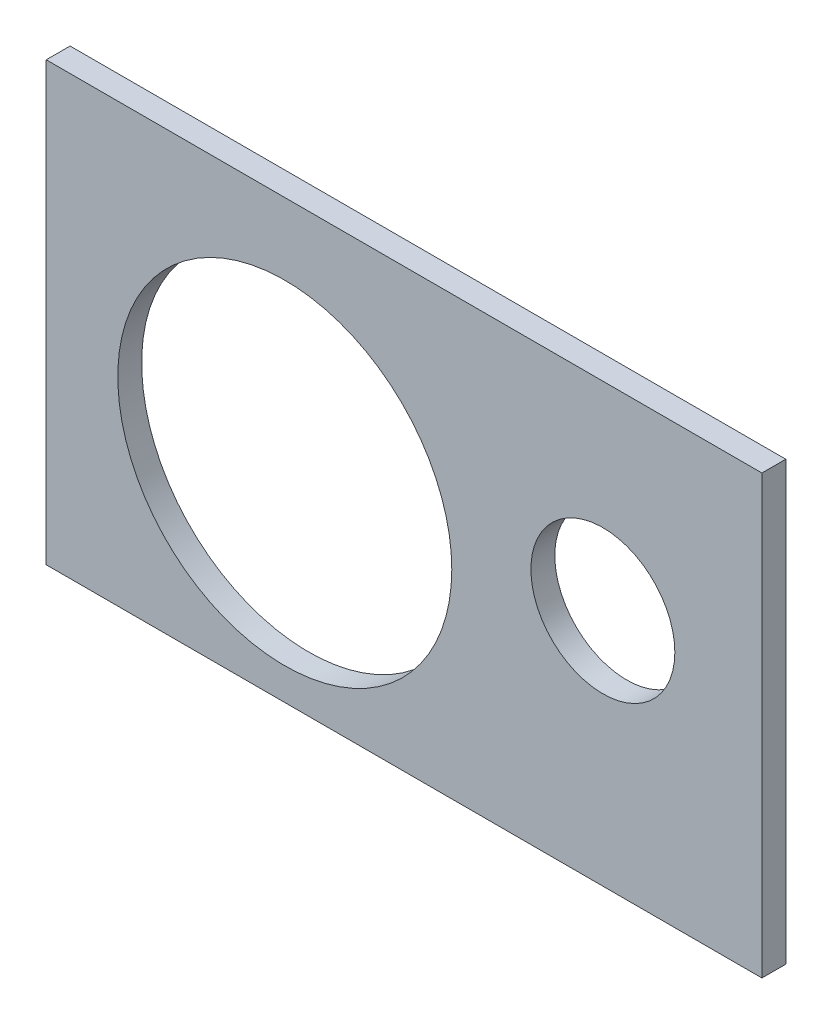
from build123d import *

# Parameters (mm, degrees)
SKETCH1_W           = 180
SKETCH1_H           = 110
SKETCH1_R           = 42
SKETCH1_R_2         = 18.1
BOSS_EXTRUDE1_DEPTH = 6


with BuildPart() as part:
    # Sketch1 → Boss-Extrude1 (new body)
    with BuildSketch(Plane.XY):
        with Locations((90, 55)):
            Rectangle(SKETCH1_W, SKETCH1_H)
        with Locations((60, 50)):
            Circle(SKETCH1_R, mode=Mode.SUBTRACT)
        with Locations((140, 60)):
            Circle(SKETCH1_R_2, mode=Mode.SUBTRACT)
    extrude(amount=BOSS_EXTRUDE1_DEPTH)


solid = part.part
